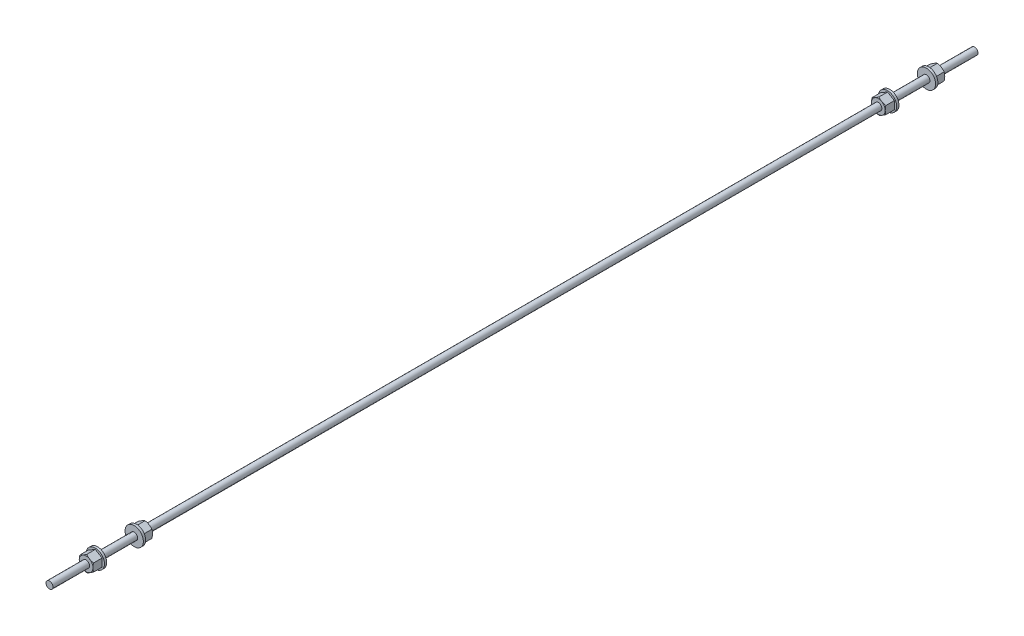
from build123d import *

# Parameters (mm, degrees)
EXTRUDE1_DEPTH          = 7.9375
SKETCH13_R              = 6.35
EXTRUDE3_DEPTH          = 1.5875
SKETCH2_OUTSIDE_W       = 63.61
SKETCH2_OUTSIDE_H       = 63.61
SKETCH2_OUTSIDE_R       = 4.7625
CUT_EXTRUDE1_DEPTH      = 12.985362166
CUT_EXTRUDE1_DRAFT      = -60
SKETCH14_R              = 2.413
BOSS_EXTRUDE1_DEPTH     = 12.7
MIRROR1_COPY_1_SKETCH_W = 63.61
MIRROR1_COPY_1_SKETCH_H = 63.61
MIRROR1_COPY_1_SKETCH_R = 4.7625
MIRROR1_COPY_1_DEPTH    = 12.985362166
MIRROR1_COPY_1_DRAFT    = -60
SKETCH15_R              = 2.413
BOSS_EXTRUDE2_DEPTH     = 254
MIRROR2_COPY_1_SKETCH_W = 63.61
MIRROR2_COPY_1_SKETCH_H = 63.61
MIRROR2_COPY_1_SKETCH_R = 4.7625
MIRROR2_COPY_1_DEPTH    = 12.985362166
MIRROR2_COPY_1_DRAFT    = -60
MIRROR2_COPY_2_DEPTH    = 7.9375
MIRROR2_COPY_3_SKETCH_R = 6.35
MIRROR2_COPY_3_DEPTH    = 1.5875
MIRROR2_COPY_4_SKETCH_R = 2.413
MIRROR2_COPY_4_DEPTH    = 12.7
MIRROR2_COPY_5_SKETCH_W = 63.61
MIRROR2_COPY_5_SKETCH_H = 63.61
MIRROR2_COPY_5_SKETCH_R = 4.7625
MIRROR2_COPY_5_DEPTH    = 12.985362166
MIRROR2_COPY_5_DRAFT    = -60
SKETCH16_R              = 2.413
BOSS_EXTRUDE3_DEPTH     = 25.4
BOSS_EXTRUDE4_START     = 25.4
SKETCH4_R               = 2.413
BOSS_EXTRUDE4_DEPTH     = 25.4


with BuildPart() as part:
    # Sketch1 → Extrude1 (new body)
    with BuildSketch(Plane.XY):
        Polygon((0, 5.499261314), (-4.7625, 2.749630657), (-4.7625, -2.749630657), (0, -5.499261314), (4.7625, -2.749630657), (4.7625, 2.749630657), align=None)
    extrude1 = extrude(amount=-EXTRUDE1_DEPTH)

    # Sketch13 → Extrude3 (add)
    with BuildSketch(Plane(origin=(0, 0, -7.9375), x_dir=(-1, 0, 0), z_dir=(0, 0, -1))):
        Circle(SKETCH13_R)
    extrude3 = extrude(amount=-EXTRUDE3_DEPTH)


with BuildPart() as cut_extrude1_tool:
    # Sketch2 outside → Cut-Extrude1 (with draft: the straight prism first)
    with BuildSketch(Plane.XY):
        Rectangle(SKETCH2_OUTSIDE_W, SKETCH2_OUTSIDE_H)
        Circle(SKETCH2_OUTSIDE_R, mode=Mode.SUBTRACT)
    extrude(amount=-CUT_EXTRUDE1_DEPTH)
    # Cut-Extrude1: the draft: its side faces are tilted about the plane it starts from
    cut_extrude1_sides = [cut_extrude1_tool.faces().sort_by_distance(p)[0] for p in [
        (0, -31.805, -6.492681083),
        (31.805, 0, -6.492681083),
        (0, 31.805, -6.492681083),
        (-31.805, 0, -6.492681083),
        (-4.7625, 0, -6.492681083),
    ]]
    draft(cut_extrude1_sides, Plane.XY, CUT_EXTRUDE1_DRAFT)


with BuildPart() as part_1:
    add(part.part)

    # Cut-Extrude1: cut by cut_extrude1_tool
    add(cut_extrude1_tool.part, mode=Mode.SUBTRACT)

    # Sketch14 → Boss-Extrude1 (add)
    with BuildSketch(Plane(origin=(0, 0, -7.9375), x_dir=(-1, 0, 0), z_dir=(0, 0, -1))):
        Circle(SKETCH14_R)
    boss_extrude1 = extrude(amount=BOSS_EXTRUDE1_DEPTH)

    # Mirror1: Extrude1, Extrude3, Boss-Extrude1 across plane
    add(extrude1.mirror(Plane(origin=(0, 0, -20.6375), x_dir=(1, 0, 0), z_dir=(0, 0, -1))))
    add(extrude3.mirror(Plane(origin=(0, 0, -20.6375), x_dir=(1, 0, 0), z_dir=(0, 0, -1))))
    add(boss_extrude1.mirror(Plane(origin=(0, 0, -20.6375), x_dir=(1, 0, 0), z_dir=(0, 0, -1))))


with BuildPart() as mirror1_copy_1_tool:
    # Mirror1 copy 1 sketch → Mirror1 copy 1 (with draft: the straight prism first)
    with BuildSketch(Plane(origin=(0, 0, -41.275), x_dir=(1, 0, 0), z_dir=(0, 0, -1))):
        Rectangle(MIRROR1_COPY_1_SKETCH_W, MIRROR1_COPY_1_SKETCH_H)
        Circle(MIRROR1_COPY_1_SKETCH_R, mode=Mode.SUBTRACT)
    extrude(amount=-MIRROR1_COPY_1_DEPTH)
    # Mirror1 copy 1: the draft: its side faces are tilted about the plane it starts from
    mirror1_copy_1_sides = [mirror1_copy_1_tool.faces().sort_by_distance(p)[0] for p in [
        (0, -31.805, -34.782318917),
        (31.805, 0, -34.782318917),
        (0, 31.805, -34.782318917),
        (-31.805, 0, -34.782318917),
        (-4.7625, 0, -34.782318917),
    ]]
    draft(mirror1_copy_1_sides, Plane(origin=(0, 0, -41.275), x_dir=(1, 0, 0), z_dir=(0, 0, -1)), MIRROR1_COPY_1_DRAFT)


with BuildPart() as part_2:
    add(part_1.part)

    # Mirror1 copy 1: cut by mirror1_copy_1_tool
    add(mirror1_copy_1_tool.part, mode=Mode.SUBTRACT)

    # Sketch15 → Boss-Extrude2 (add)
    with BuildSketch(Plane(origin=(0, 0, -41.275), x_dir=(-1, 0, 0), z_dir=(0, 0, -1))):
        Circle(SKETCH15_R)
    boss_extrude2 = extrude(amount=BOSS_EXTRUDE2_DEPTH)

    # Mirror2: Extrude1, Extrude3, Boss-Extrude1, Boss-Extrude2 across plane
    add(extrude1.mirror(Plane(origin=(0, 0, -295.275), x_dir=(1, 0, 0), z_dir=(0, 0, -1))))
    add(extrude3.mirror(Plane(origin=(0, 0, -295.275), x_dir=(1, 0, 0), z_dir=(0, 0, -1))))
    add(boss_extrude1.mirror(Plane(origin=(0, 0, -295.275), x_dir=(1, 0, 0), z_dir=(0, 0, -1))))
    add(boss_extrude2.mirror(Plane(origin=(0, 0, -295.275), x_dir=(1, 0, 0), z_dir=(0, 0, -1))))


with BuildPart() as mirror2_copy_1_tool:
    # Mirror2 copy 1 sketch → Mirror2 copy 1 (with draft: the straight prism first)
    with BuildSketch(Plane(origin=(0, 0, -590.55), x_dir=(1, 0, 0), z_dir=(0, 0, -1))):
        Rectangle(MIRROR2_COPY_1_SKETCH_W, MIRROR2_COPY_1_SKETCH_H)
        Circle(MIRROR2_COPY_1_SKETCH_R, mode=Mode.SUBTRACT)
    extrude(amount=-MIRROR2_COPY_1_DEPTH)
    # Mirror2 copy 1: the draft: its side faces are tilted about the plane it starts from
    mirror2_copy_1_sides = [mirror2_copy_1_tool.faces().sort_by_distance(p)[0] for p in [
        (0, -31.805, -584.057318917),
        (31.805, 0, -584.057318917),
        (0, 31.805, -584.057318917),
        (-31.805, 0, -584.057318917),
        (-4.7625, 0, -584.057318917),
    ]]
    draft(mirror2_copy_1_sides, Plane(origin=(0, 0, -590.55), x_dir=(1, 0, 0), z_dir=(0, 0, -1)), MIRROR2_COPY_1_DRAFT)


with BuildPart() as part_3:
    add(part_2.part)

    # Mirror2 copy 1: cut by mirror2_copy_1_tool
    add(mirror2_copy_1_tool.part, mode=Mode.SUBTRACT)

    # Mirror2 copy 2 sketch → Mirror2 copy 2 (add)
    with BuildSketch(Plane.XY.offset(-549.275)):
        Polygon((0, 5.499261314), (-4.7625, 2.749630657), (-4.7625, -2.749630657), (0, -5.499261314), (4.7625, -2.749630657), (4.7625, 2.749630657), align=None)
    extrude(amount=-MIRROR2_COPY_2_DEPTH)

    # Mirror2 copy 3 sketch → Mirror2 copy 3 (add)
    with BuildSketch(Plane(origin=(0, 0, -557.2125), x_dir=(-1, 0, 0), z_dir=(0, 0, -1))):
        Circle(MIRROR2_COPY_3_SKETCH_R)
    extrude(amount=-MIRROR2_COPY_3_DEPTH)

    # Mirror2 copy 4 sketch → Mirror2 copy 4 (add)
    with BuildSketch(Plane(origin=(0, 0, -557.2125), x_dir=(-1, 0, 0), z_dir=(0, 0, -1))):
        Circle(MIRROR2_COPY_4_SKETCH_R)
    extrude(amount=MIRROR2_COPY_4_DEPTH)


with BuildPart() as mirror2_copy_5_tool:
    # Mirror2 copy 5 sketch → Mirror2 copy 5 (with draft: the straight prism first)
    with BuildSketch(Plane.XY.offset(-549.275)):
        Rectangle(MIRROR2_COPY_5_SKETCH_W, MIRROR2_COPY_5_SKETCH_H)
        Circle(MIRROR2_COPY_5_SKETCH_R, mode=Mode.SUBTRACT)
    extrude(amount=-MIRROR2_COPY_5_DEPTH)
    # Mirror2 copy 5: the draft: its side faces are tilted about the plane it starts from
    mirror2_copy_5_sides = [mirror2_copy_5_tool.faces().sort_by_distance(p)[0] for p in [
        (0, -31.805, -555.767681083),
        (31.805, 0, -555.767681083),
        (0, 31.805, -555.767681083),
        (-31.805, 0, -555.767681083),
        (-4.7625, 0, -555.767681083),
    ]]
    draft(mirror2_copy_5_sides, Plane.XY.offset(-549.275), MIRROR2_COPY_5_DRAFT)


with BuildPart() as part_4:
    add(part_3.part)

    # Mirror2 copy 5: cut by mirror2_copy_5_tool
    add(mirror2_copy_5_tool.part, mode=Mode.SUBTRACT)

    # Sketch16 → Boss-Extrude3 (add)
    with BuildSketch(Plane(origin=(0, 0, -590.55), x_dir=(-1, 0, 0), z_dir=(0, 0, -1))):
        Circle(SKETCH16_R)
    extrude(amount=BOSS_EXTRUDE3_DEPTH)

    # Sketch4 → Boss-Extrude4 (add)
    with BuildSketch(Plane.XY.offset(BOSS_EXTRUDE4_START)):
        Circle(SKETCH4_R)
    extrude(amount=-BOSS_EXTRUDE4_DEPTH)


solid = part_4.part
